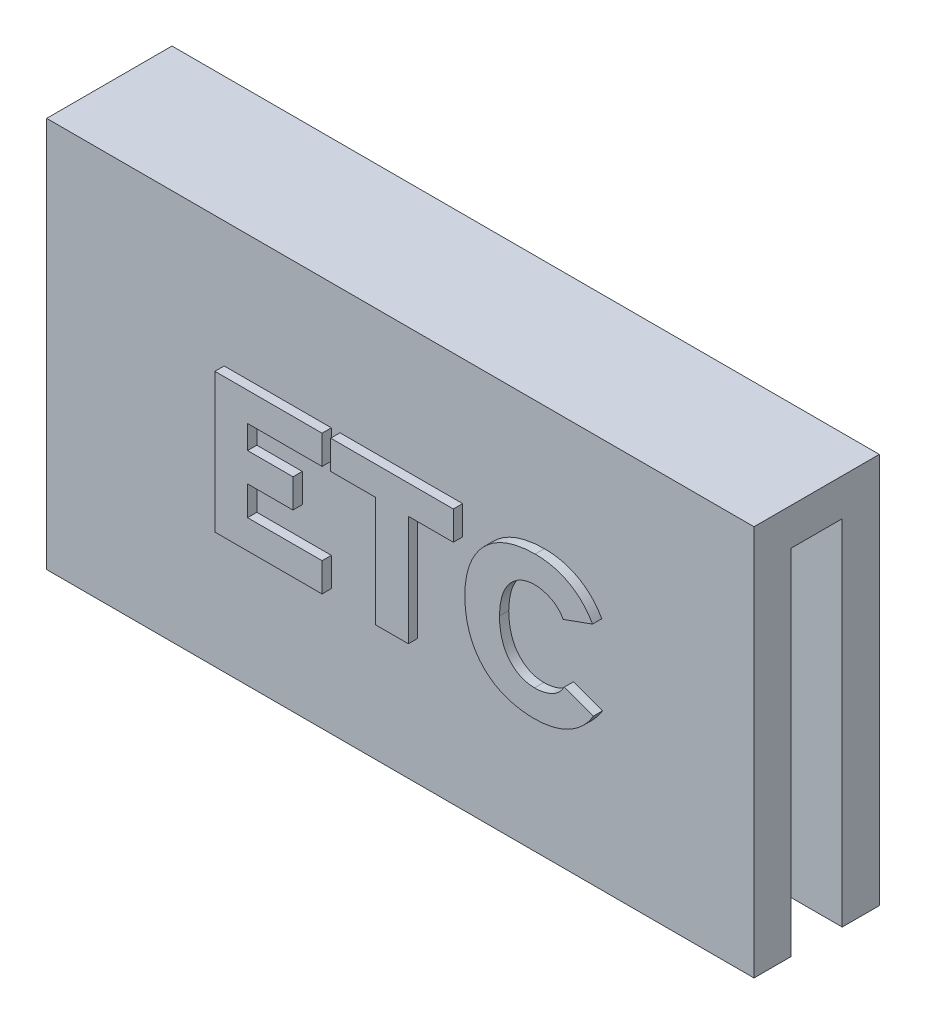
from build123d import *

# Parameters (mm, degrees)
BOSS_EXTRUDE1_DEPTH = 38.1
BOSS_EXTRUDE3_DEPTH = 1


with BuildPart() as part:
    # Sketch1 → Boss-Extrude1 (new, symmetric)
    with BuildSketch(Plane(origin=(0, 0, 0), x_dir=(0, 0, -1), z_dir=(1, 0, 0))):
        Polygon((0, 0), (0, 42.1), (13.5, 42.1), (13.5, 0), (9.5, 0), (9.5, 38.1), (4, 38.1), (4, 0), align=None)
    extrude(amount=BOSS_EXTRUDE1_DEPTH, both=True)

    # Sketch2 → Boss-Extrude3 (add, symmetric)
    with BuildSketch(Plane.XY):
        Polygon((-18.978268083, 13.563043481), (-7.432465912, 13.563043481), (-7.432465912, 16.667391966), (-15.45652502, 16.667391966), (-15.45652502, 19.823911191), (-10.565455283, 19.823911191), (-10.565455283, 22.928262861), (-15.45652502, 22.928262861), (-15.45652502, 25.458691811), (-7.432465912, 25.458691811), (-7.432465912, 28.563043481), (-18.978268083, 28.563043481), align=None)
        Polygon((-1.656525275, 25.458691811), (-1.656525275, 13.563040297), (1.865217787, 13.563040297), (1.865217787, 25.458691811), (6.711208541, 25.458691811), (6.711208541, 28.563043481), (-6.502516029, 28.563043481), (-6.502516029, 25.458691811), align=None)
        with BuildLine():
            add(Edge.make_bspline(
                [(15.438010665, 13.354347785), (15.613848071, 13.357630463), (15.961031082, 13.364111965), (16.474654754, 13.411096326), (16.972171178, 13.485551459), (17.454350309, 13.587537093), (17.921191278, 13.713462214), (18.372413835, 13.87019558), (18.806299305, 14.057145814), (19.224396801, 14.267998676), (19.62105836, 14.507647047), (20.000947253, 14.763973763), (20.357078311, 15.045438005), (20.690791783, 15.349202886), (21.000195841, 15.67605595), (21.288865767, 16.0227109), (21.553346106, 16.392023311), (21.712403606, 16.651185833), (21.792395931, 16.781522425)],
                knots=[0, 0, 0, 0, 1.114731516, 2.200987007, 3.267230555, 4.302559281, 5.324033743, 6.330944734, 7.328139711, 8.317469177, 9.297247604, 10.264439228, 11.221263555, 12.172512456, 13.12306213, 14.072486967, 15.030625733, 16, 16, 16, 16], degree=3))
            Line((21.792395931, 16.781522425), (18.661158004, 17.921116969))
            add(Edge.make_bspline(
                [(18.661158004, 17.921116969), (18.566142898, 17.770347591), (18.382374328, 17.478744768), (18.035847344, 17.1095741), (17.653216776, 16.807442725), (17.226654473, 16.5901622), (16.784761606, 16.433853803), (16.341391417, 16.322448631), (15.900130925, 16.25194395), (15.605691887, 16.250644501), (15.459785891, 16.250000573)],
                knots=[0, 0, 0, 0, 1.124265888, 2.174440921, 3.183250871, 4.191311752, 5.184581575, 6.141144096, 7.078864596, 8, 8, 8, 8], degree=3))
            add(Edge.make_bspline(
                [(15.459785891, 16.250000573), (15.325868683, 16.253636955), (15.062146264, 16.260798061), (14.676143778, 16.321002302), (14.30834646, 16.418243461), (13.96106351, 16.556649348), (13.631582624, 16.730943204), (13.320258731, 16.943550146), (13.029944099, 17.197863471), (12.755372588, 17.483666739), (12.505294115, 17.807719504), (12.292402346, 18.170756697), (12.107556135, 18.566967238), (11.955643697, 18.997350983), (11.83449674, 19.464210924), (11.748643361, 19.964949555), (11.692662798, 20.500991731), (11.680301914, 20.869427608), (11.673915522, 21.059784203)],
                knots=[0, 0, 0, 0, 0.934364169, 1.840038213, 2.719788101, 3.584888763, 4.443610747, 5.316990073, 6.209925091, 7.132976365, 8.079947799, 9.05978502, 10.06454016, 11.12767488, 12.24106468, 13.427352276, 14.670812229, 16, 16, 16, 16], degree=3))
            add(Edge.make_bspline(
                [(11.673915522, 21.059784203), (11.680410009, 21.245783623), (11.693046462, 21.607686445), (11.74790407, 22.133038589), (11.835539645, 22.625878468), (11.956241633, 23.085809187), (12.105130697, 23.515593171), (12.287977713, 23.912519184), (12.504177996, 24.275802916), (12.748474271, 24.606251247), (13.018962027, 24.898738239), (13.308184532, 25.155744816), (13.613977341, 25.375877987), (13.941406604, 25.552894744), (14.284330797, 25.694220328), (14.645498727, 25.794966149), (15.023838976, 25.859059138), (15.2823526, 25.868179477), (15.414133707, 25.872828703)],
                knots=[0, 0, 0, 0, 1.30919797, 2.547332886, 3.712933366, 4.827776921, 5.889604948, 6.909284468, 7.896912538, 8.859012154, 9.795324587, 10.694644368, 11.577456046, 12.439891886, 13.307635073, 14.181657699, 15.073073372, 16, 16, 16, 16], degree=3))
            add(Edge.make_bspline(
                [(15.414133707, 25.872828703), (15.56774105, 25.870461993), (15.872549917, 25.86576564), (16.322831507, 25.785239185), (16.76293275, 25.661952301), (17.189163253, 25.486847341), (17.593906505, 25.258093455), (17.955718527, 24.957021829), (18.28419621, 24.600848952), (18.458609885, 24.322714727), (18.547830025, 24.180437039)],
                knots=[0, 0, 0, 0, 0.984646415, 1.95387116, 2.925653959, 3.914247462, 4.905127984, 5.89674513, 6.924094153, 8, 8, 8, 8], degree=3))
            Line((18.547830025, 24.180437039), (21.703989407, 25.318592215))
            add(Edge.make_bspline(
                [(21.703989407, 25.318592215), (21.628699004, 25.448999887), (21.479515161, 25.707395604), (21.22580907, 26.073861924), (20.952844823, 26.420556685), (20.654158252, 26.743129542), (20.337172203, 27.048053012), (19.998060046, 27.332501272), (19.633924935, 27.593159127), (19.250727614, 27.835060137), (18.845658846, 28.049149469), (18.424136005, 28.240582911), (17.982658179, 28.3981957), (17.526331446, 28.534427399), (17.050288776, 28.633318574), (16.558454045, 28.709107964), (16.047565077, 28.754674873), (15.701177178, 28.763826797), (15.525003296, 28.768481492)],
                knots=[0, 0, 0, 0, 0.971244069, 1.924467354, 2.873009264, 3.816090622, 4.758545902, 5.709496038, 6.669096502, 7.645944055, 8.631114741, 9.62307713, 10.63031822, 11.653427311, 12.693345176, 13.764576584, 14.86305722, 16, 16, 16, 16], degree=3))
            add(Edge.make_bspline(
                [(15.525003296, 28.768481492), (15.238806502, 28.759057121), (14.679752433, 28.740647646), (13.865888401, 28.634712511), (13.099436337, 28.469846107), (12.379737199, 28.241880755), (11.708038356, 27.946777252), (11.082017574, 27.590657913), (10.503120271, 27.171073889), (9.978748105, 26.6858848), (9.505110224, 26.149989725), (9.096231328, 25.560567013), (8.744252018, 24.927968439), (8.457263687, 24.245369356), (8.232415411, 23.515470475), (8.071843847, 22.737971264), (7.963738278, 21.914922355), (7.948180876, 21.349268459), (7.940219077, 21.059784203)],
                knots=[0, 0, 0, 0, 1.125201103, 2.197957025, 3.221338869, 4.203792769, 5.160483765, 6.100199762, 7.030129938, 7.964614181, 8.903241419, 9.836170966, 10.7791457, 11.744226424, 12.741703441, 13.776723667, 14.862195594, 16, 16, 16, 16], degree=3))
            add(Edge.make_bspline(
                [(7.940219077, 21.059784203), (7.948863135, 20.768211491), (7.965716386, 20.19973453), (8.063877783, 19.371638527), (8.223756781, 18.591835198), (8.440472928, 17.859613346), (8.719279131, 17.175413605), (9.057616498, 16.53962124), (9.463405377, 15.955841288), (9.922674567, 15.419527568), (10.438061355, 14.939167652), (11.007353586, 14.521463317), (11.62659656, 14.169601164), (12.294011615, 13.876956175), (13.010417886, 13.650186582), (13.77558642, 13.484639343), (14.589452851, 13.378025327), (15.149665198, 13.362374185), (15.436959799, 13.354347785)],
                knots=[0, 0, 0, 0, 1.150502408, 2.243125248, 3.285225207, 4.287928616, 5.25157168, 6.195575321, 7.123475059, 8.051017943, 8.976536055, 9.896922795, 10.830474245, 11.781059771, 12.767079268, 13.7899854, 14.866634651, 16, 16, 16, 16], degree=3))
            Line((15.436959799, 13.354347785), (15.438010665, 13.354347785))
        make_face()
    extrude(amount=BOSS_EXTRUDE3_DEPTH, both=True)


solid = part.part
